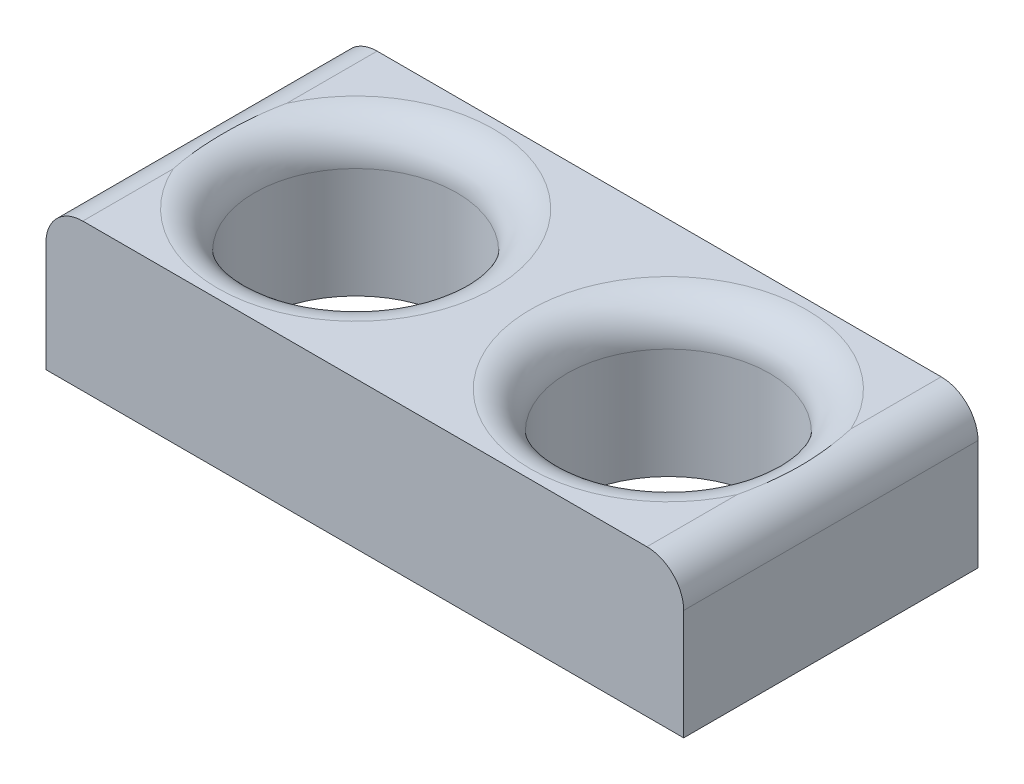
from build123d import *

# Parameters (mm, degrees)
SKETCH1_W           = 52
SKETCH1_H           = 24
SKETCH1_R           = 8.25
BOSS_EXTRUDE1_DEPTH = 12
SKETCH2_R           = 1
CUT_EXTRUDE1_DEPTH  = 32.048349393
SKETCH3_R           = 1.75
CUT_EXTRUDE2_DEPTH  = 1
CUT_EXTRUDE3_DEPTH  = 5
FILLET2_R           = 0.5
SKETCH6_W           = 10
SKETCH6_H           = 10
SKETCH6_R           = 2
BOSS_EXTRUDE2_DEPTH = 5
FILLET3_R           = 4.6
FILLET4_R           = 3
SKETCH9_R           = 1.75
BOSS_EXTRUDE3_DEPTH = 12
SKETCH10_W          = 13.41545795
SKETCH10_H          = 24
SKETCH10_W_2        = 15.564044944
CUT_EXTRUDE4_DEPTH  = 39.587562763
FILLET5_R           = 3


with BuildPart() as part:
    # Sketch1 → Boss-Extrude1 (new body)
    with BuildSketch(Plane(origin=(0, 0, 0), x_dir=(1, 0, 0), z_dir=(0, 1, 0))):
        Rectangle(SKETCH1_W, SKETCH1_H)
        with Locations(Location((12.75, 0, 0), (0, 0, 270))):
            Circle(SKETCH1_R, mode=Mode.SUBTRACT)
        with Locations(Location((-12.75, 0, 0), (0, 0, 270))):
            Circle(SKETCH1_R, mode=Mode.SUBTRACT)
    extrude(amount=BOSS_EXTRUDE1_DEPTH)

    # Sketch2 → Cut-Extrude1 (cut, through all)
    with BuildSketch(Plane(origin=(0, 12, 0), x_dir=(1, 0, 0), z_dir=(0, 1, 0))):
        with Locations(Location((-21.35, 8.85, 0), (0, 0, 270))):
            Circle(SKETCH2_R)
        with Locations(Location((21.35, 8.85, 0), (0, 0, 270))):
            Circle(SKETCH2_R)
        with Locations(Location((21.35, -8.85, 0), (0, 0, 270))):
            Circle(SKETCH2_R)
        with Locations(Location((-21.35, -8.85, 0), (0, 0, 270))):
            Circle(SKETCH2_R)
    extrude(amount=-CUT_EXTRUDE1_DEPTH, mode=Mode.SUBTRACT)

    # Sketch3 → Cut-Extrude2 (cut)
    with BuildSketch(Plane(origin=(0, 12, 0), x_dir=(1, 0, 0), z_dir=(0, 1, 0))):
        with Locations(Location((-21.35, 8.85, 0), (0, 0, 270))):
            Circle(SKETCH3_R)
        with Locations(Location((21.35, 8.85, 0), (0, 0, 270))):
            Circle(SKETCH3_R)
        with Locations(Location((21.35, -8.85, 0), (0, 0, 270))):
            Circle(SKETCH3_R)
        with Locations(Location((-21.35, -8.85, 0), (0, 0, 270))):
            Circle(SKETCH3_R)
    extrude(amount=-CUT_EXTRUDE2_DEPTH, mode=Mode.SUBTRACT)

    # Sketch4 → Cut-Extrude3 (cut)
    with BuildSketch(Plane.XZ):
        Polygon((-6, -5), (-6, -12), (6, -12), (6, -5), (0, -5), align=None)
    extrude(amount=-CUT_EXTRUDE3_DEPTH, mode=Mode.SUBTRACT)

    # Fillet2
    fillet2_edges = [part.edges().sort_by_distance(p)[0] for p in [
        (0, 5, -12),
        (6, 2.5, -12),
        (-6, 2.5, -12),
        (-6, 2.5, -5),
        (6, 5, -8.5),
        (6, 2.5, -5),
        (-6, 5, -8.5),
        (0, 5, -5),
    ]]
    fillet(fillet2_edges, radius=FILLET2_R)

    # Sketch6 → Boss-Extrude2 (add)
    # profile 1 of 2: a face of its own
    with BuildSketch(Plane(origin=(0, 12, 0), x_dir=(1, 0, 0), z_dir=(0, 1, 0))):
        with Locations((-31, 0)):
            Rectangle(SKETCH6_W, SKETCH6_H)
        with Locations(Location((-31, 0, 0), (0, 0, 270))):
            Circle(SKETCH6_R, mode=Mode.SUBTRACT)
    # profile 2 of 2: a face of its own
    with BuildSketch(Plane(origin=(0, 12, 0), x_dir=(1, 0, 0), z_dir=(0, 1, 0))):
        with Locations((31, 0)):
            Rectangle(SKETCH6_W, SKETCH6_H)
        with Locations(Location((31, 0, 0), (0, 0, 90))):
            Circle(SKETCH6_R, mode=Mode.SUBTRACT)
    extrude(amount=-BOSS_EXTRUDE2_DEPTH)

    # Fillet3
    fillet3_edges = [part.edges().sort_by_distance(p)[0] for p in [
        (-26, 9.5, -5),
        (-26, 9.5, 5),
        (26, 9.5, -5),
        (26, 9.5, 5),
    ]]
    fillet(fillet3_edges, radius=FILLET3_R)

    # Fillet4
    fillet4_edges = [part.edges().sort_by_distance(p)[0] for p in [
        (-36, 9.5, 5),
        (-36, 9.5, -5),
        (36, 9.5, -5),
        (36, 9.5, 5),
    ]]
    fillet(fillet4_edges, radius=FILLET4_R)

    # Sketch9 → Boss-Extrude3 (add)
    with BuildSketch(Plane(origin=(0, 12, 0), x_dir=(1, 0, 0), z_dir=(0, 1, 0))):
        with Locations((-21.35, -8.85)):
            Circle(SKETCH9_R)
        with Locations((21.35, -8.85)):
            Circle(SKETCH9_R)
        with Locations((21.35, 8.85)):
            Circle(SKETCH9_R)
        with Locations((-21.35, 8.85)):
            Circle(SKETCH9_R)
    extrude(amount=-BOSS_EXTRUDE3_DEPTH)

    # Sketch10 → Cut-Extrude4 (cut, through all)
    with BuildSketch(Plane.XZ.offset(-7)):
        with Locations((-32.707728975, 0)):
            Rectangle(SKETCH10_W, SKETCH10_H)
        with Locations((33.782022472, 0)):
            Rectangle(SKETCH10_W_2, SKETCH10_H)
    extrude(amount=-CUT_EXTRUDE4_DEPTH, mode=Mode.SUBTRACT)

    # Fillet5
    # the kernel refuses this fillet: 3 mm, written as the material it takes off along each edge
    with BuildSketch(Plane(origin=(-26, 12, -19.5), x_dir=(1, 0, 0), z_dir=(0, 0, 1)), Plane(origin=(26, 12, 19.5), x_dir=(-1, 0, 0), z_dir=(0, 0, -1))) as fillet5_piece_1:
        with BuildLine():
            CenterArc((FILLET5_R, -FILLET5_R), FILLET5_R, 90, 90)
            Line((0, -FILLET5_R), (0, 0))
            Line((0, 0), (FILLET5_R, 0))
        make_face()
    extrude(amount=39, mode=Mode.SUBTRACT)
    with BuildSketch(Plane(origin=(12.75, 12, 0), x_dir=(0, 0, 1), z_dir=(-1, 0, 0))) as fillet5_piece_2:
        with BuildLine():
            CenterArc((8.25 + FILLET5_R, -FILLET5_R), FILLET5_R, 90, 90)
            Line((8.25, -FILLET5_R), (8.25, 0))
            Line((8.25, 0), (8.25 + FILLET5_R, 0))
        make_face()
    revolve(axis=Axis((12.75, 12, 0), (0, 1, 0)), mode=Mode.SUBTRACT)
    with BuildSketch(Plane(origin=(-12.75, 12, 0), x_dir=(0, 0, 1), z_dir=(-1, 0, 0))) as fillet5_piece_3:
        with BuildLine():
            CenterArc((8.25 + FILLET5_R, -FILLET5_R), FILLET5_R, 90, 90)
            Line((8.25, -FILLET5_R), (8.25, 0))
            Line((8.25, 0), (8.25 + FILLET5_R, 0))
        make_face()
    revolve(axis=Axis((-12.75, 12, 0), (0, 1, 0)), mode=Mode.SUBTRACT)


solid = part.part
